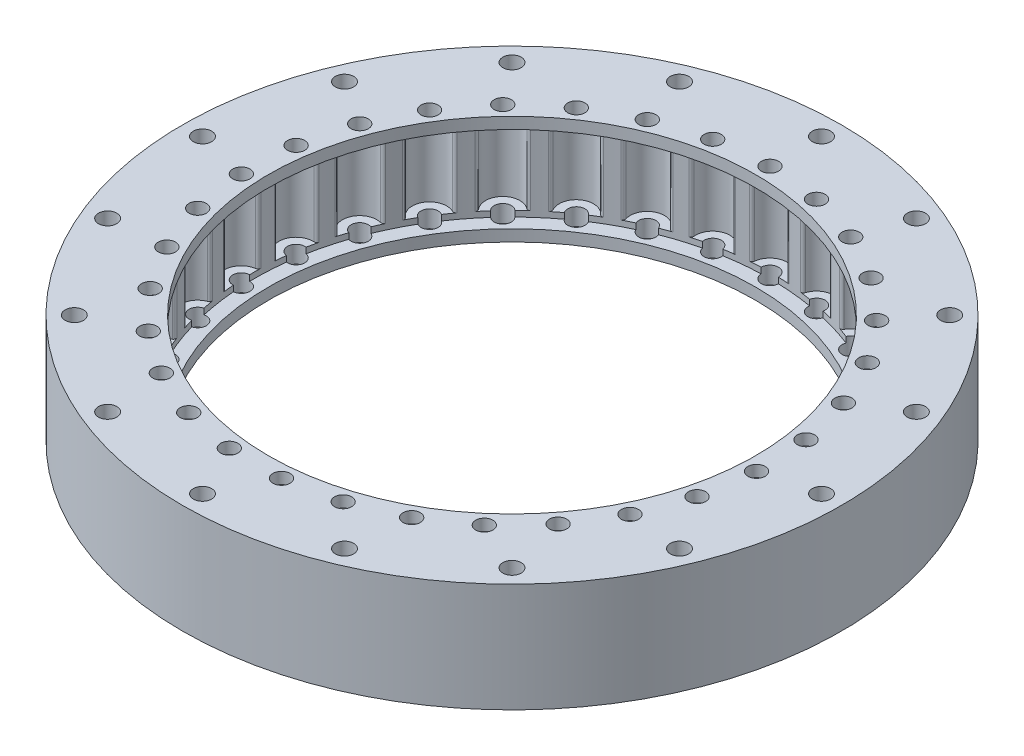
from build123d import *

# Parameters (mm, degrees)
SKETCH1_R                = 57.5
SKETCH1_R_2              = 45
BOSS_EXTRUDE1_DEPTH      = 13
BOSS_EXTRUDE2_START      = 1
SKETCH2_R                = 57.5
SKETCH2_R_2              = 45
BOSS_EXTRUDE2_DEPTH      = 1
BOSS_EXTRUDE3_START      = 2
SKETCH3_R                = 57.5
SKETCH3_R_2              = 42.5
BOSS_EXTRUDE3_DEPTH      = 2
SKETCH5_R                = 3
CUT_EXTRUDE2_DEPTH       = 13
FILLET4_R                = 0.5
SKETCH10_R               = 57.5
SKETCH10_R_2             = 45
BOSS_EXTRUDE4_DEPTH      = 1
SKETCH11_R               = 57.5
SKETCH11_R_2             = 42.5
BOSS_EXTRUDE5_DEPTH      = 2
SKETCH7_R                = 1.5
CUT_EXTRUDE3_DEPTH       = 23
CIRPATTERN3_COUNT        = 31
FILLET4_OF_CIRPATTERN3_R = 0.5
SKETCH4_R                = 1.6
CUT_EXTRUDE1_DEPTH       = 51


with BuildPart() as part:
    # Sketch1 → Boss-Extrude1 (new body)
    with BuildSketch(Plane(origin=(0, 0, 0), x_dir=(1, 0, 0), z_dir=(0, 1, 0))):
        Circle(SKETCH1_R)
        Circle(SKETCH1_R_2, mode=Mode.SUBTRACT)
    extrude(amount=BOSS_EXTRUDE1_DEPTH)

    # Sketch2 → Boss-Extrude2 (add)
    with BuildSketch(Plane.XZ.offset(BOSS_EXTRUDE2_START)):
        Circle(SKETCH2_R)
        Circle(SKETCH2_R_2, mode=Mode.SUBTRACT)
    extrude(amount=-BOSS_EXTRUDE2_DEPTH)

    # Sketch3 → Boss-Extrude3 (add)
    with BuildSketch(Plane.XZ.offset(1).offset(BOSS_EXTRUDE3_START)):
        Circle(SKETCH3_R)
        Circle(SKETCH3_R_2, mode=Mode.SUBTRACT)
    extrude(amount=-BOSS_EXTRUDE3_DEPTH)

    # Sketch5 → Cut-Extrude2 (cut)
    with BuildSketch(Plane(origin=(0, 13, 0), x_dir=(1, 0, 0), z_dir=(0, 1, 0))):
        with Locations((0, 45)):
            Circle(SKETCH5_R)
    cut_extrude2 = extrude(amount=-CUT_EXTRUDE2_DEPTH, mode=Mode.SUBTRACT)

    # Fillet4
    fillet4_edges = [part.edges().sort_by_distance(p)[0] for p in [
        (2.99833287, 6.5, -44.9),
        (-2.99833287, 6.5, -44.9),
    ]]
    fillet(fillet4_edges, radius=FILLET4_R)

    # Sketch10 → Boss-Extrude4 (add)
    with BuildSketch(Plane(origin=(0, 13, 0), x_dir=(1, 0, 0), z_dir=(0, 1, 0))):
        Circle(SKETCH10_R)
        Circle(SKETCH10_R_2, mode=Mode.SUBTRACT)
    extrude(amount=BOSS_EXTRUDE4_DEPTH)

    # Sketch11 → Boss-Extrude5 (add)
    with BuildSketch(Plane(origin=(0, 14, 0), x_dir=(1, 0, 0), z_dir=(0, 1, 0))):
        Circle(SKETCH11_R)
        Circle(SKETCH11_R_2, mode=Mode.SUBTRACT)
    extrude(amount=BOSS_EXTRUDE5_DEPTH)

    # Sketch7 → Cut-Extrude3 (cut)
    with BuildSketch(Plane(origin=(0, 16, 0), x_dir=(1, 0, 0), z_dir=(0, 1, 0))):
        with Locations((0, 45)):
            Circle(SKETCH7_R)
    cut_extrude3 = extrude(amount=-CUT_EXTRUDE3_DEPTH, mode=Mode.SUBTRACT)

    # CirPattern3: Cut-Extrude2, Cut-Extrude3 ×31 about axis
    cirpattern3_axis = Axis((0, -3, 0), (0, 1, 0))
    add([cut_extrude2.rotate(cirpattern3_axis, i * 360 / CIRPATTERN3_COUNT) for i in range(1, CIRPATTERN3_COUNT)], mode=Mode.SUBTRACT)
    add([cut_extrude3.rotate(cirpattern3_axis, i * 360 / CIRPATTERN3_COUNT) for i in range(1, CIRPATTERN3_COUNT)], mode=Mode.SUBTRACT)

    # Fillet4 of CirPattern3
    fillet4_of_cirpattern3_edges = [part.edges().sort_by_distance(p)[0] for p in [
        (-6.101346732, 6.5, -44.584454332),
        (-11.975260372, 6.5, -43.377334393),
        (-14.951236482, 6.5, -42.443615865),
        (-20.461919307, 6.5, -40.078795619),
        (-23.189020853, 6.5, -38.565130777),
        (-28.110864862, 6.5, -35.139426243),
        (-30.477443987, 6.5, -33.107784704),
        (-34.608948306, 6.5, -28.761444629),
        (-36.518116982, 6.5, -26.295002036),
        (-39.690137341, 6.5, -21.205966091),
        (-41.063733978, 6.5, -18.405698895),
        (-43.146407489, 6.5, -12.782312811),
        (-43.92819688, 6.5, -9.762864278),
        (-44.836258645, 6.5, -3.835350142),
        (-44.99423424, 6.5, -0.720336851),
        (-44.690508104, 6.5, 5.268632212),
        (-44.218202364, 6.5, 8.351681252),
        (-42.715122911, 6.5, 14.156916145),
        (-41.631872087, 6.5, 17.081780543),
        (-38.990975566, 6.5, 22.465614267),
        (-37.341128076, 6.5, 25.112549731),
        (-33.670533101, 6.5, 29.854567501),
        (-31.521633894, 6.5, 32.115208183),
        (-26.971615054, 6.5, 36.021271235),
        (-24.411640317, 6.5, 37.803066239),
        (-19.168475919, 6.5, 40.713259891),
        (-16.302231317, 6.5, 41.943262321),
        (-10.580577126, 6.5, 43.738442904),
        (-7.525407051, 6.5, 44.366296315),
        (-1.559508263, 6.5, 44.972968926),
        (1.559508263, 6.5, 44.972968926),
        (7.525407051, 6.5, 44.366296315),
        (10.580577126, 6.5, 43.738442904),
        (16.302231317, 6.5, 41.943262321),
        (19.168475919, 6.5, 40.713259891),
        (24.411640317, 6.5, 37.803066239),
        (26.971615054, 6.5, 36.021271235),
        (31.521633894, 6.5, 32.115208183),
        (33.670533101, 6.5, 29.854567501),
        (37.341128076, 6.5, 25.112549731),
        (38.990975566, 6.5, 22.465614267),
        (41.631872087, 6.5, 17.081780543),
        (42.715122911, 6.5, 14.156916145),
        (44.218202364, 6.5, 8.351681252),
        (44.690508104, 6.5, 5.268632212),
        (44.99423424, 6.5, -0.720336851),
        (44.836258645, 6.5, -3.835350142),
        (43.92819688, 6.5, -9.762864278),
        (43.146407489, 6.5, -12.782312811),
        (41.063733978, 6.5, -18.405698895),
        (39.690137341, 6.5, -21.205966091),
        (36.518116982, 6.5, -26.295002036),
        (34.608948306, 6.5, -28.761444629),
        (30.477443987, 6.5, -33.107784704),
        (28.110864862, 6.5, -35.139426243),
        (23.189020853, 6.5, -38.565130777),
        (20.461919307, 6.5, -40.078795619),
        (14.951236482, 6.5, -42.443615865),
        (11.975260372, 6.5, -43.377334393),
        (6.101346732, 6.5, -44.584454332),
    ]]
    fillet(fillet4_of_cirpattern3_edges, radius=FILLET4_OF_CIRPATTERN3_R)

    # Sketch4 → Cut-Extrude1 (cut)
    with BuildSketch(Plane(origin=(0, 16, 0), x_dir=(1, 0, 0), z_dir=(0, 1, 0))):
        with Locations((0, 54)):
            Circle(SKETCH4_R)
        with Locations((20.664905348, 49.889494756)):
            Circle(SKETCH4_R)
        with Locations((38.183766184, 38.183766184)):
            Circle(SKETCH4_R)
        with Locations((49.889494756, 20.664905348)):
            Circle(SKETCH4_R)
        with Locations((54, 0)):
            Circle(SKETCH4_R)
        with Locations((49.889494756, -20.664905348)):
            Circle(SKETCH4_R)
        with Locations((38.183766184, -38.183766184)):
            Circle(SKETCH4_R)
        with Locations((20.664905348, -49.889494756)):
            Circle(SKETCH4_R)
        with Locations((0, -54)):
            Circle(SKETCH4_R)
        with Locations((-20.664905348, -49.889494756)):
            Circle(SKETCH4_R)
        with Locations((-38.183766184, -38.183766184)):
            Circle(SKETCH4_R)
        with Locations((-49.889494756, -20.664905348)):
            Circle(SKETCH4_R)
        with Locations((-54, 0)):
            Circle(SKETCH4_R)
        with Locations((-49.889494756, 20.664905348)):
            Circle(SKETCH4_R)
        with Locations((-38.183766184, 38.183766184)):
            Circle(SKETCH4_R)
        with Locations((-20.664905348, 49.889494756)):
            Circle(SKETCH4_R)
    extrude(amount=-CUT_EXTRUDE1_DEPTH, mode=Mode.SUBTRACT)


solid = part.part
